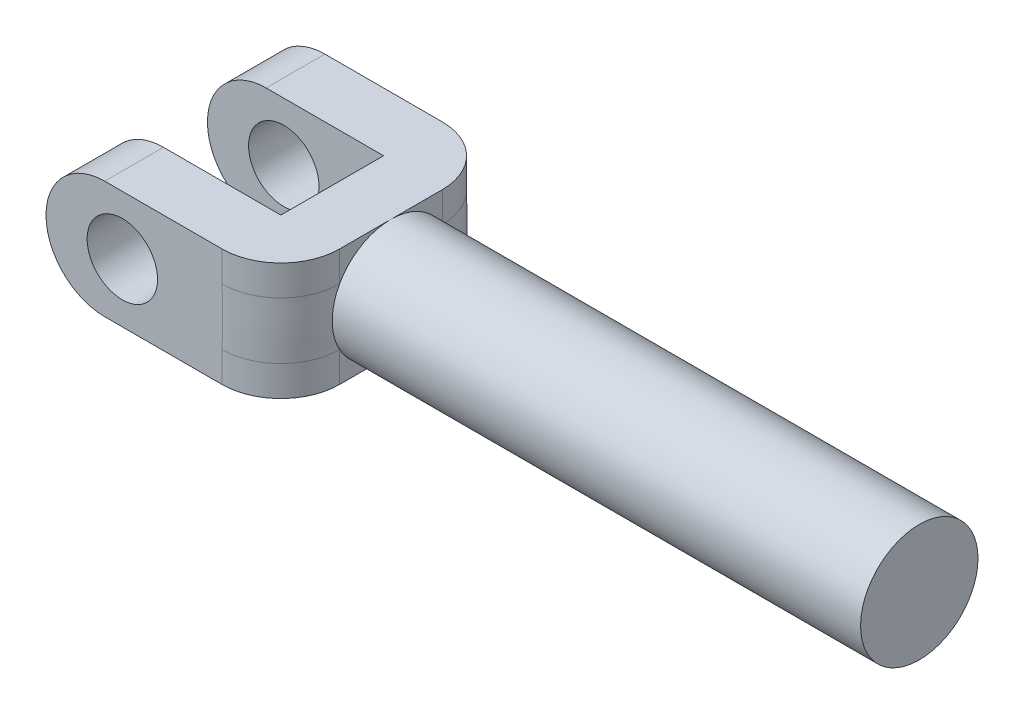
from build123d import *

# Parameters (mm, degrees)
SKETCH1_R                = 1
BOSS_EXTRUDE1_DEPTH      = 10
BOSS_EXTRUDE2_DEPTH      = 1
BOSS_EXTRUDE2_DEPTH_BACK = 1
FILLET1_R                = 1
SKETCH3_R                = 0.6
CUT_EXTRUDE1_DEPTH       = 5


with BuildPart() as part:
    # Sketch1 → Boss-Extrude1 (new body)
    with BuildSketch(Plane(origin=(0, 0, 0), x_dir=(0, 0, -1), z_dir=(1, 0, 0))):
        Circle(SKETCH1_R)
    extrude(amount=BOSS_EXTRUDE1_DEPTH)

    # Sketch2 → Boss-Extrude2 (add, two sides: drawn at the far end of the back side and taken through both)
    with BuildSketch(Plane(origin=(0, 0, 0), x_dir=(1, 0, 0), z_dir=(0, 1, 0)).offset(-BOSS_EXTRUDE2_DEPTH_BACK)):
        Polygon((1, 1.875), (1, -1.875), (-3, -1.875), (-3, -0.875), (0, -0.875), (0, 0.875), (-3, 0.875), (-3, 1.875), align=None)
    extrude(amount=BOSS_EXTRUDE2_DEPTH + BOSS_EXTRUDE2_DEPTH_BACK)

    # Fillet1
    fillet1_edges = [part.edges().sort_by_distance(p)[0] for p in [
        (-3, 1, -1.375),
        (-3, -1, -1.375),
        (-3, -1, 1.375),
        (-3, 1, 1.375),
        (1, 0, -1.875),
        (1, 0, 1.875),
    ]]
    fillet(fillet1_edges, radius=FILLET1_R - 0.0001)  # a hair under: the kernel refuses the full size

    # Sketch3 → Cut-Extrude1 (cut)
    with BuildSketch(Plane(origin=(0, 0, -1.875), x_dir=(-1, 0, 0), z_dir=(0, 0, -1))):
        with Locations((1.7, 0)):
            Circle(SKETCH3_R)
    extrude(amount=-CUT_EXTRUDE1_DEPTH, mode=Mode.SUBTRACT)


solid = part.part
